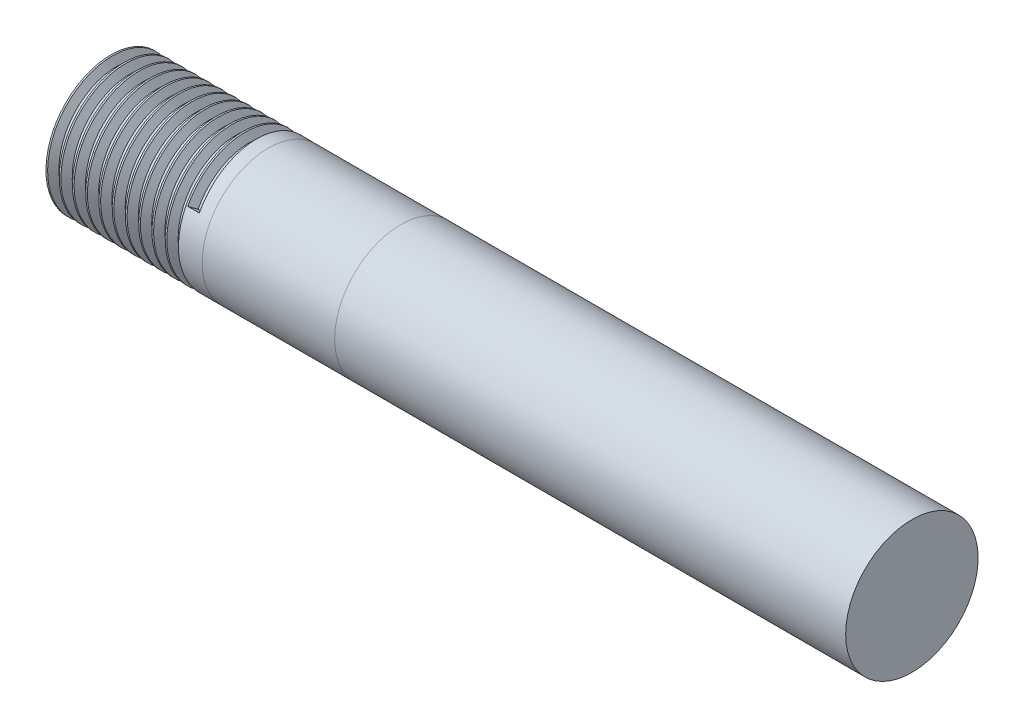
from build123d import *

# Parameters (mm, degrees)
SKETCH1_W     = 77.15065003
SKETCH1_H     = 6.35
THREAD1_PITCH = 1.27


with BuildPart() as part:
    # Sketch1 → Revolve1 (revolve)
    with BuildSketch(Plane.XY, mode=Mode.PRIVATE) as revolve1_sk:
        with Locations((38.575325015, 3.175)):
            Rectangle(SKETCH1_W, SKETCH1_H)
    revolve(revolve1_sk.sketch.rotate(Axis((-315.96266582, 0, 0), (1, 0, 0)), 90), axis=Axis((-315.96266582, 0, 0), (1, 0, 0)))

    # Thread1: the profile of Thread Profile1 profile screwed along a right-hand helix of 11.417323 turns, 8 arcs to a turn; built about Z, then put on its axis
    thread1_z = Axis((0, 0, 0), (0, 0, 1))
    thread1_corners = [(6.3503, 0, -0.000173205), (6.3503, 0, 1.111423202), (5.662592339, 0, 0.714374998), (5.662592339, 0, 0.396874998)]
    with BuildLine(mode=Mode.PRIVATE) as thread1_profile:
        Line(thread1_corners[0], thread1_corners[1])
        Line(thread1_corners[1], thread1_corners[2])
        Line(thread1_corners[2], thread1_corners[3])
        Line(thread1_corners[3], thread1_corners[0])
    thread1_cap = Face(thread1_profile.wire())
    thread1_turn_angles = [0, 22.5, 45, 67.5, 90, 112.5, 135, 157.5, 180, 202.5, 225, 247.5, 270, 292.5, 315, 337.5, 360]
    thread1_turn_weights = [1, 0.9238795325112867, 1, 0.9238795325112867, 1, 0.9238795325112867, 1, 0.9238795325112867, 1, 0.9238795325112867, 1, 0.9238795325112867, 1, 0.9238795325112867, 1, 0.9238795325112867, 1]
    thread1_turn_rails = [Edge.make_bspline([Vector(p[0], p[1], 0).rotate(thread1_z, thread1_turn_angles[k]) / thread1_turn_weights[k] + Vector(0, 0, p[2] + THREAD1_PITCH * thread1_turn_angles[k] / 360) for k in range(17)], [0, 0, 0, 1, 1, 2, 2, 3, 3, 4, 4, 5, 5, 6, 6, 7, 7, 8, 8, 8], 2, thread1_turn_weights) for p in thread1_corners]
    thread1_turn_sides = [Face.make_surface_from_curves(thread1_turn_rails[p[0]], thread1_turn_rails[p[1]]) for p in [(0, 1), (1, 2), (2, 3), (3, 0)]]
    thread1_last_angles = [3960, 3982.5, 4005, 4027.5, 4050, 4072.5, 4095, 4102.618110236, 4110.236220472]
    thread1_last_weights = [1, 0.9238795325112867, 1, 0.9238795325112867, 1, 0.9238795325112867, 1, 0.9911736867070363, 1]
    thread1_last_rails = [Edge.make_bspline([Vector(p[0], p[1], 0).rotate(thread1_z, thread1_last_angles[k]) / thread1_last_weights[k] + Vector(0, 0, p[2] + THREAD1_PITCH * thread1_last_angles[k] / 360) for k in range(9)], [0, 0, 0, 1, 1, 2, 2, 3, 3, 4, 4, 4], 2, thread1_last_weights) for p in thread1_corners]
    thread1_last_sides = [Face.make_surface_from_curves(thread1_last_rails[p[0]], thread1_last_rails[p[1]]) for p in [(0, 1), (1, 2), (2, 3), (3, 0)]]
    thread1 = Plane(origin=(-1.27, 0, 0), x_dir=(0, 0, -1), z_dir=(1, 0, 0)) * Solid(Shell([*[p.moved(Location((0, 0, THREAD1_PITCH * i))) for i in range(11) for p in thread1_turn_sides], *thread1_last_sides, thread1_cap, thread1_cap.rotate(thread1_z, 4110.236220472).moved(Location((0, 0, THREAD1_PITCH * 4110.236220472 / 360)))]))
    add(thread1, mode=Mode.SUBTRACT)


solid = part.part
